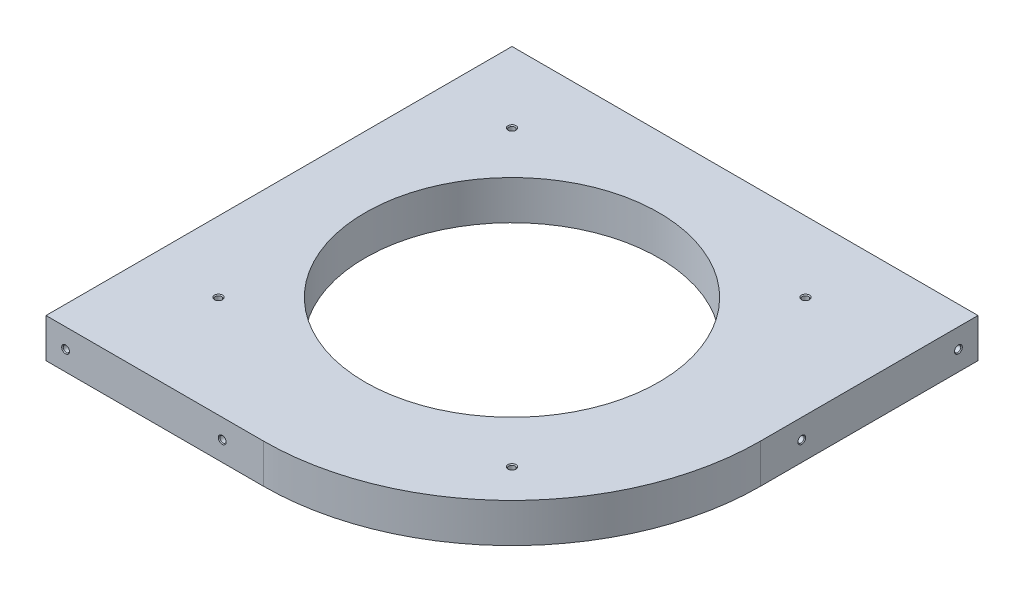
from build123d import *

# Parameters (mm, degrees)
SKETCH1_R                           = 37.5
BOSS_EXTRUDE1_DEPTH                 = 10
M2X0_4_TAPPED_HOLE2_D               = 1.6
M2X0_4_TAPPED_HOLE2_CSINK_D         = 2.05
M2X0_4_TAPPED_HOLE2_CSINK_ANGLE     = 90
M2X0_4_TAPPED_HOLE1_D               = 1.6
M2X0_4_TAPPED_HOLE1_DEPTH           = 6
M2X0_4_TAPPED_HOLE1_TIP             = 0.480688495
M2X0_4_TAPPED_HOLE1_ON_FACE_2_D     = 1.6
M2X0_4_TAPPED_HOLE1_ON_FACE_2_DEPTH = 6
M2X0_4_TAPPED_HOLE1_ON_FACE_2_TIP   = 0.480688495
CHAMFER1_SIZE                       = 0.2


with BuildPart() as part:
    # Sketch1 → Boss-Extrude1 (new body)
    with BuildSketch(Plane(origin=(0, 0, 0), x_dir=(1, 0, 0), z_dir=(0, 1, 0))):
        with BuildLine():
            Line((-55.5, 55.5), (63.5, 55.5))
            Line((63.5, 55.5), (63.5, 0))
            ThreePointArc((63.5, 0), (44.901280605, -44.901280605), (0, -63.5))
            Line((0, -63.5), (-55.5, -63.5))
            Line((-55.5, -63.5), (-55.5, 55.5))
        make_face()
        Circle(SKETCH1_R, mode=Mode.SUBTRACT)
    extrude(amount=BOSS_EXTRUDE1_DEPTH)

    # M2x0.4 Tapped Hole2 (through all)
    with Locations(Plane(origin=(0, 10, 0), x_dir=(1, 0, 0), z_dir=(0, 1, 0))):
        with Locations((37.476659403, 37.476659403), (-37.476659403, 37.476659403), (-37.476659403, -37.476659403), (37.476659403, -37.476659403)):
            CounterSinkHole(M2X0_4_TAPPED_HOLE2_D / 2, M2X0_4_TAPPED_HOLE2_CSINK_D / 2, counter_sink_angle=M2X0_4_TAPPED_HOLE2_CSINK_ANGLE)

    # M2x0.4 Tapped Hole1
    with Locations(Plane(origin=(63.5, 5, -50.5), x_dir=(0, 0, 1), z_dir=(1, 0, 0))):
        with Locations((0, 0), (40, 0)):
            Hole(M2X0_4_TAPPED_HOLE1_D / 2, depth=M2X0_4_TAPPED_HOLE1_DEPTH)
            with Locations((0, 0, -(M2X0_4_TAPPED_HOLE1_DEPTH + M2X0_4_TAPPED_HOLE1_TIP / 2))):  # 118° drill point
                Cone(0, M2X0_4_TAPPED_HOLE1_D / 2, M2X0_4_TAPPED_HOLE1_TIP, mode=Mode.SUBTRACT)

    # M2x0.4 Tapped Hole1 on face 2
    with Locations(Plane(origin=(-50.5, 5, 63.5), x_dir=(1, 0, 0), z_dir=(0, 0, 1))):
        with Locations((0, 0), (40, 0)):
            Hole(M2X0_4_TAPPED_HOLE1_ON_FACE_2_D / 2, depth=M2X0_4_TAPPED_HOLE1_ON_FACE_2_DEPTH)
            with Locations((0, 0, -(M2X0_4_TAPPED_HOLE1_ON_FACE_2_DEPTH + M2X0_4_TAPPED_HOLE1_ON_FACE_2_TIP / 2))):  # 118° drill point
                Cone(0, M2X0_4_TAPPED_HOLE1_ON_FACE_2_D / 2, M2X0_4_TAPPED_HOLE1_ON_FACE_2_TIP, mode=Mode.SUBTRACT)

    # Chamfer1
    chamfer1_edges = [part.edges().sort_by_distance(p)[0] for p in [
        (63.5, 5, -49.7),
        (63.5, 5, -9.7),
        (-49.7, 5, 63.5),
        (-9.7, 5, 63.5),
    ]]
    chamfer(chamfer1_edges, length=CHAMFER1_SIZE)


solid = part.part
